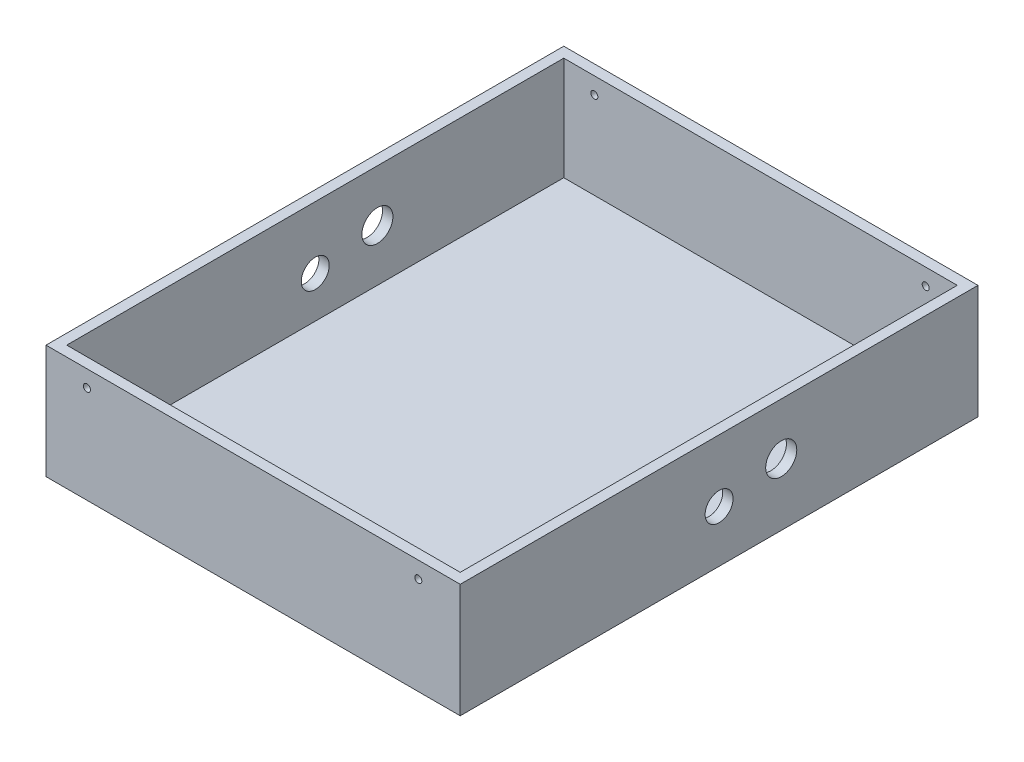
from build123d import *

# Parameters (mm, degrees)
SKETCH1_W               = 190
SKETCH1_H               = 50
BOSS_EXTRUDE1_DEPTH     = 120
SHELL1_T                = 5
CUT_EXTRUDE2_DEPTH      = 242.091269025
CUT_EXTRUDE2_DEPTH_BACK = 242.091269025
SKETCH3_R               = 6.75
M3_CLEARANCE_HOLE1_D    = 3.4
CUT_EXTRUDE4_DEPTH      = 168.705098312
CUT_EXTRUDE4_DEPTH_BACK = 168.705098312
SKETCH8_R               = 7.5


with BuildPart() as part:
    # Sketch1 → Boss-Extrude1 (new, symmetric)
    with BuildSketch(Plane.XY):
        with Locations((0, 25)):
            Rectangle(SKETCH1_W, SKETCH1_H)
    extrude(amount=BOSS_EXTRUDE1_DEPTH, both=True)

    # Shell1
    shell1_openings = [part.faces().sort_by_distance(p)[0] for p in [
        (0, 50, 0),
    ]]
    offset(amount=SHELL1_T, openings=shell1_openings, kind=Kind.INTERSECTION)

    # Sketch3 → Cut-Extrude2 (cut, two sides: drawn at the far end of the back side and taken through both)
    with BuildSketch(Plane(origin=(100, 0, 0), x_dir=(0, 0, -1), z_dir=(1, 0, 0)).offset(-CUT_EXTRUDE2_DEPTH_BACK)):
        with Locations((0, 20)):
            Circle(SKETCH3_R)
    extrude(amount=CUT_EXTRUDE2_DEPTH + CUT_EXTRUDE2_DEPTH_BACK, mode=Mode.SUBTRACT)

    # M3 Clearance Hole1 (through all)
    with Locations(Plane.XY.offset(125)):
        with Locations((-80.25, 42), (79.75, 42)):
            Hole(M3_CLEARANCE_HOLE1_D / 2)

    # Sketch8 → Cut-Extrude4 (cut, two sides: drawn at the far end of the back side and taken through both)
    with BuildSketch(Plane(origin=(0, 0, 0), x_dir=(0, 0, -1), z_dir=(1, 0, 0)).offset(-CUT_EXTRUDE4_DEPTH_BACK)):
        with Locations((30, 25)):
            Circle(SKETCH8_R)
    extrude(amount=CUT_EXTRUDE4_DEPTH + CUT_EXTRUDE4_DEPTH_BACK, mode=Mode.SUBTRACT)


solid = part.part
